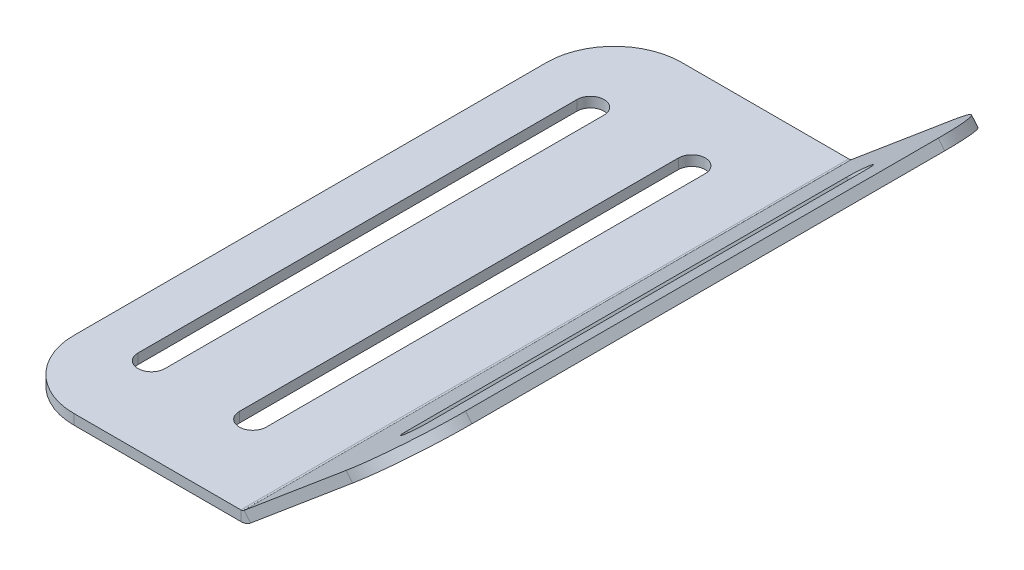
from build123d import *

# Parameters (mm, degrees)
SM_BASE_FLANGE_1_DEPTH = 90
CUT_EXTRUDE_1_DEPTH    = 10
CUT_EXTRUDE_2_DEPTH    = 10
FILLET_1_R             = 10


# Sheet-metal steps are written as plain solids
with BuildPart() as part:
    # Sketch 1 → 基体-法兰1 (new body)
    with BuildSketch(Plane.XY):
        with BuildLine():
            Line((0, 0), (34.731899525, 0))
            ThreePointArc((34.731899525, 0), (34.983831563, 0.044422416), (35.205376879, 0.172331663))
            Line((35.205376879, 0.172331663), (57.981333294, 19.283628291))
            Line((57.981333294, 19.283628291), (58.945514708, 18.134561626))
            Line((58.945514708, 18.134561626), (36.169558293, -0.976735001))
            ThreePointArc((36.169558293, -0.976735001), (35.496861778, -1.365116516), (34.731899525, -1.5))
            Line((34.731899525, -1.5), (0, -1.5))
            Line((0, -1.5), (0, 0))
        make_face()
    extrude(amount=SM_BASE_FLANGE_1_DEPTH)

    # 草图6 → 切除-拉伸1 (cut)
    with BuildSketch(Plane(origin=(0, 0, 0), x_dir=(1, 0, 0), z_dir=(0, 1, 0))):
        with BuildLine():
            Line((11, -12.5), (11, -77.5))
            ThreePointArc((11, -77.5), (9, -79.5), (7, -77.5))
            Line((7, -77.5), (7, -12.5))
            ThreePointArc((7, -12.5), (9, -10.5), (11, -12.5))
        make_face()
        with BuildLine():
            Line((26, -12.5), (26, -77.5))
            ThreePointArc((26, -77.5), (24, -79.5), (22, -77.5))
            Line((22, -77.5), (22, -12.5))
            ThreePointArc((22, -12.5), (24, -10.5), (26, -12.5))
        make_face()
    extrude(amount=-CUT_EXTRUDE_1_DEPTH, mode=Mode.SUBTRACT)

    # 草图7 → 切除-拉伸2 (cut)
    with BuildSketch(Plane(origin=(14.461156891, -17.234135678, 0), x_dir=(0, 0, 1), z_dir=(-0.6427876096865403, 0.7660444431189772, 0))):
        with BuildLine():
            Line((12.5, 46.311555509), (77.5, 46.311555509))
            ThreePointArc((77.5, 46.311555509), (79.5, 44.311555509), (77.5, 42.311555509))
            Line((77.5, 42.311555509), (12.5, 42.311555509))
            ThreePointArc((12.5, 42.311555509), (10.5, 44.311555509), (12.5, 46.311555509))
        make_face()
    extrude(amount=-CUT_EXTRUDE_2_DEPTH, mode=Mode.SUBTRACT)

    # 圆角1
    fillet_1_edges = [part.edges().sort_by_distance(p)[0] for p in [
        (0, -0.75, 90),
        (0, -0.75, 0),
        (58.463424001, 18.709094958, 90),
        (58.463424001, 18.709094958, 0),
    ]]
    fillet(fillet_1_edges, radius=FILLET_1_R)


solid = part.part
